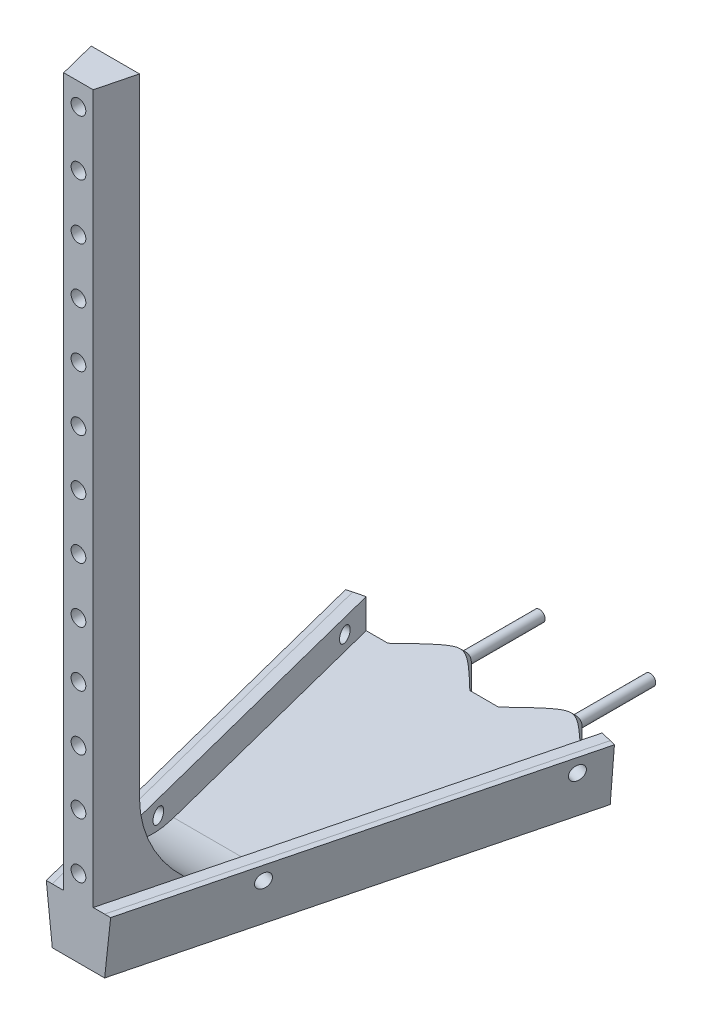
from build123d import *

# Parameters (mm, degrees)
BOSS_EXTRU_1_DEPTH                  = 7
BOSS_EXTRU_3_DEPTH                  = 200
ENL_V_MAT_EXTRU_1_REACH             = 232.486
ESQUISSE4_R                         = 2
ENL_V_MAT_EXTRU_1_DIRECTION_2_DEPTH = 231.486442118
CONG_1_R                            = 30
ESQUISSE6_R                         = 1.5
BOSS_EXTRU_4_DEPTH                  = 30
CHANFREIN1_SIZE                     = 10
R_P_TITION_LIN_AIRE1_COUNT          = 13
R_P_TITION_LIN_AIRE1_PITCH          = 15
BOSS_EXTRU_5_REACH                  = 238.518
ENL_V_MAT_EXTRU_2_REACH             = 249.28
ESQUISSE9_R                         = 2


with BuildPart() as part:
    # Esquisse1 → Boss.-Extru.1 (new body)
    with BuildSketch(Plane(origin=(0, 0, 0), x_dir=(1, 0, 0), z_dir=(0, 1, 0))):
        Polygon((-4, 0), (4, 0), (32, 110), (-32, 110), align=None)
    extrude(amount=-BOSS_EXTRU_1_DEPTH)

    # Esquisse3 → Boss.-Extru.3 (add)
    with BuildSketch(Plane(origin=(0, 0, 0), x_dir=(1, 0, 0), z_dir=(0, 1, 0))):
        Polygon((6.545454545, 10), (-6.545454545, 10), (-4, 0), (4, 0), align=None)
    extrude(amount=BOSS_EXTRU_3_DEPTH)

    # Esquisse4 → Enlèv. mat.-Extru.1 (cut, up to next)
    with BuildSketch(Plane.XY, mode=Mode.PRIVATE) as enl_v_mat_extru_1_sk1:
        with Locations(Location((0, 194, 0), (0, 0, 180))):
            Circle(ESQUISSE4_R)
    enl_v_mat_extru_1_tool1 = extrude(enl_v_mat_extru_1_sk1.sketch, amount=-ENL_V_MAT_EXTRU_1_REACH, mode=Mode.PRIVATE) & part.part
    enl_v_mat_extru_1 = enl_v_mat_extru_1_tool1.solids().sort_by_distance((0, 194, 0))[0]
    add(enl_v_mat_extru_1, mode=Mode.SUBTRACT)

    # Esquisse4 → Enlèv. mat.-Extru.1 direction 2 (cut)
    with BuildSketch(Plane.XY):
        with Locations(Location((0, 194, 0), (0, 0, 180))):
            Circle(ESQUISSE4_R)
    enl_v_mat_extru_1_direction_2 = extrude(amount=ENL_V_MAT_EXTRU_1_DIRECTION_2_DEPTH, mode=Mode.SUBTRACT)

    # Congé1
    cong_1_edges = [part.edges().sort_by_distance(p)[0] for p in [
        (0, 0, -10),
    ]]
    fillet(cong_1_edges, radius=CONG_1_R)

    # Esquisse6 → Boss.-Extru.4 (add)
    with BuildSketch(Plane(origin=(0, 0, -110), x_dir=(-1, 0, 0), z_dir=(0, 0, -1))):
        with Locations((-15, -3)):
            Circle(ESQUISSE6_R)
        with Locations((15, -3)):
            Circle(ESQUISSE6_R)
    extrude(amount=BOSS_EXTRU_4_DEPTH)

    # Chanfrein1
    # the kernel refuses this chamfer: 10 mm, written as the material it adds along each edge
    with BuildSketch(Plane(origin=(15, -3, -110), x_dir=(-1, 0, 0), z_dir=(0, -1, 0))) as chanfrein1_piece_1_section:
        Polygon((1.5 + CHANFREIN1_SIZE, 0), (1.5, CHANFREIN1_SIZE), (1.5, 0), align=None)
    chanfrein1_piece_1 = revolve(axis=Axis((15, -3, -110), (0, 0, -1)), mode=Mode.PRIVATE)
    chanfrein1_piece_1 = split(chanfrein1_piece_1, bisect_by=Plane(origin=(21.433559927, 0, -114.933559927), z_dir=(0, -1, 0)), keep=Keep.TOP, mode=Mode.PRIVATE)
    chanfrein1_piece_1 = split(chanfrein1_piece_1, bisect_by=Plane(origin=(21.433559927, -7, -114.933559927), z_dir=(0, 1, 0)), keep=Keep.TOP, mode=Mode.PRIVATE)
    add(chanfrein1_piece_1)
    with BuildSketch(Plane(origin=(-15, -3, -110), x_dir=(-1, 0, 0), z_dir=(0, -1, 0))) as chanfrein1_piece_2_section:
        Polygon((1.5 + CHANFREIN1_SIZE, 0), (1.5, CHANFREIN1_SIZE), (1.5, 0), align=None)
    chanfrein1_piece_2 = revolve(axis=Axis((-15, -3, -110), (0, 0, -1)), mode=Mode.PRIVATE)
    chanfrein1_piece_2 = split(chanfrein1_piece_2, bisect_by=Plane(origin=(-8.566440073, 0, -114.933559927), z_dir=(0, -1, 0)), keep=Keep.TOP, mode=Mode.PRIVATE)
    chanfrein1_piece_2 = split(chanfrein1_piece_2, bisect_by=Plane(origin=(-8.566440073, -7, -114.933559927), z_dir=(0, 1, 0)), keep=Keep.TOP, mode=Mode.PRIVATE)
    add(chanfrein1_piece_2)

    # Répétition linéaire1: Enlèv. mat.-Extru.1, Enlèv. mat.-Extru.1 direction 2; each copy of Enlèv. mat.-Extru.1 runs up to whatever stops it at its own place
    r_p_tition_lin_aire1_before = part.part  # the part as the pattern finds it: every copy runs up to it
    r_p_tition_lin_aire1_enl_v_mat_extru_1_long = extrude(enl_v_mat_extru_1_sk1.sketch, amount=-ENL_V_MAT_EXTRU_1_REACH, mode=Mode.PRIVATE)
    r_p_tition_lin_aire1_enl_v_mat_extru_1_tool1 = r_p_tition_lin_aire1_enl_v_mat_extru_1_long.moved(Location(Vector(0, -1, 0) * (1 * R_P_TITION_LIN_AIRE1_PITCH))) & r_p_tition_lin_aire1_before
    add(r_p_tition_lin_aire1_enl_v_mat_extru_1_tool1.solids().sort_by_distance((0, 179, 0))[0], mode=Mode.SUBTRACT)
    r_p_tition_lin_aire1_enl_v_mat_extru_1_tool2 = r_p_tition_lin_aire1_enl_v_mat_extru_1_long.moved(Location(Vector(0, -1, 0) * (2 * R_P_TITION_LIN_AIRE1_PITCH))) & r_p_tition_lin_aire1_before
    add(r_p_tition_lin_aire1_enl_v_mat_extru_1_tool2.solids().sort_by_distance((0, 164, 0))[0], mode=Mode.SUBTRACT)
    r_p_tition_lin_aire1_enl_v_mat_extru_1_tool3 = r_p_tition_lin_aire1_enl_v_mat_extru_1_long.moved(Location(Vector(0, -1, 0) * (3 * R_P_TITION_LIN_AIRE1_PITCH))) & r_p_tition_lin_aire1_before
    add(r_p_tition_lin_aire1_enl_v_mat_extru_1_tool3.solids().sort_by_distance((0, 149, 0))[0], mode=Mode.SUBTRACT)
    r_p_tition_lin_aire1_enl_v_mat_extru_1_tool4 = r_p_tition_lin_aire1_enl_v_mat_extru_1_long.moved(Location(Vector(0, -1, 0) * (4 * R_P_TITION_LIN_AIRE1_PITCH))) & r_p_tition_lin_aire1_before
    add(r_p_tition_lin_aire1_enl_v_mat_extru_1_tool4.solids().sort_by_distance((0, 134, 0))[0], mode=Mode.SUBTRACT)
    r_p_tition_lin_aire1_enl_v_mat_extru_1_tool5 = r_p_tition_lin_aire1_enl_v_mat_extru_1_long.moved(Location(Vector(0, -1, 0) * (5 * R_P_TITION_LIN_AIRE1_PITCH))) & r_p_tition_lin_aire1_before
    add(r_p_tition_lin_aire1_enl_v_mat_extru_1_tool5.solids().sort_by_distance((0, 119, 0))[0], mode=Mode.SUBTRACT)
    r_p_tition_lin_aire1_enl_v_mat_extru_1_tool6 = r_p_tition_lin_aire1_enl_v_mat_extru_1_long.moved(Location(Vector(0, -1, 0) * (6 * R_P_TITION_LIN_AIRE1_PITCH))) & r_p_tition_lin_aire1_before
    add(r_p_tition_lin_aire1_enl_v_mat_extru_1_tool6.solids().sort_by_distance((0, 104, 0))[0], mode=Mode.SUBTRACT)
    r_p_tition_lin_aire1_enl_v_mat_extru_1_tool7 = r_p_tition_lin_aire1_enl_v_mat_extru_1_long.moved(Location(Vector(0, -1, 0) * (7 * R_P_TITION_LIN_AIRE1_PITCH))) & r_p_tition_lin_aire1_before
    add(r_p_tition_lin_aire1_enl_v_mat_extru_1_tool7.solids().sort_by_distance((0, 89, 0))[0], mode=Mode.SUBTRACT)
    r_p_tition_lin_aire1_enl_v_mat_extru_1_tool8 = r_p_tition_lin_aire1_enl_v_mat_extru_1_long.moved(Location(Vector(0, -1, 0) * (8 * R_P_TITION_LIN_AIRE1_PITCH))) & r_p_tition_lin_aire1_before
    add(r_p_tition_lin_aire1_enl_v_mat_extru_1_tool8.solids().sort_by_distance((0, 74, 0))[0], mode=Mode.SUBTRACT)
    r_p_tition_lin_aire1_enl_v_mat_extru_1_tool9 = r_p_tition_lin_aire1_enl_v_mat_extru_1_long.moved(Location(Vector(0, -1, 0) * (9 * R_P_TITION_LIN_AIRE1_PITCH))) & r_p_tition_lin_aire1_before
    add(r_p_tition_lin_aire1_enl_v_mat_extru_1_tool9.solids().sort_by_distance((0, 59, 0))[0], mode=Mode.SUBTRACT)
    r_p_tition_lin_aire1_enl_v_mat_extru_1_tool10 = r_p_tition_lin_aire1_enl_v_mat_extru_1_long.moved(Location(Vector(0, -1, 0) * (10 * R_P_TITION_LIN_AIRE1_PITCH))) & r_p_tition_lin_aire1_before
    add(r_p_tition_lin_aire1_enl_v_mat_extru_1_tool10.solids().sort_by_distance((0, 44, 0))[0], mode=Mode.SUBTRACT)
    r_p_tition_lin_aire1_enl_v_mat_extru_1_tool11 = r_p_tition_lin_aire1_enl_v_mat_extru_1_long.moved(Location(Vector(0, -1, 0) * (11 * R_P_TITION_LIN_AIRE1_PITCH))) & r_p_tition_lin_aire1_before
    add(r_p_tition_lin_aire1_enl_v_mat_extru_1_tool11.solids().sort_by_distance((0, 29, 0))[0], mode=Mode.SUBTRACT)
    r_p_tition_lin_aire1_enl_v_mat_extru_1_tool12 = r_p_tition_lin_aire1_enl_v_mat_extru_1_long.moved(Location(Vector(0, -1, 0) * (12 * R_P_TITION_LIN_AIRE1_PITCH))) & r_p_tition_lin_aire1_before
    add(r_p_tition_lin_aire1_enl_v_mat_extru_1_tool12.solids().sort_by_distance((0, 14, 0))[0], mode=Mode.SUBTRACT)
    add(enl_v_mat_extru_1_direction_2.moved(Location(Vector(0, -1, 0) * (1 * R_P_TITION_LIN_AIRE1_PITCH))), mode=Mode.SUBTRACT)
    add(enl_v_mat_extru_1_direction_2.moved(Location(Vector(0, -1, 0) * (2 * R_P_TITION_LIN_AIRE1_PITCH))), mode=Mode.SUBTRACT)
    add(enl_v_mat_extru_1_direction_2.moved(Location(Vector(0, -1, 0) * (3 * R_P_TITION_LIN_AIRE1_PITCH))), mode=Mode.SUBTRACT)
    add(enl_v_mat_extru_1_direction_2.moved(Location(Vector(0, -1, 0) * (4 * R_P_TITION_LIN_AIRE1_PITCH))), mode=Mode.SUBTRACT)
    add(enl_v_mat_extru_1_direction_2.moved(Location(Vector(0, -1, 0) * (5 * R_P_TITION_LIN_AIRE1_PITCH))), mode=Mode.SUBTRACT)
    add(enl_v_mat_extru_1_direction_2.moved(Location(Vector(0, -1, 0) * (6 * R_P_TITION_LIN_AIRE1_PITCH))), mode=Mode.SUBTRACT)
    add(enl_v_mat_extru_1_direction_2.moved(Location(Vector(0, -1, 0) * (7 * R_P_TITION_LIN_AIRE1_PITCH))), mode=Mode.SUBTRACT)
    add(enl_v_mat_extru_1_direction_2.moved(Location(Vector(0, -1, 0) * (8 * R_P_TITION_LIN_AIRE1_PITCH))), mode=Mode.SUBTRACT)
    add(enl_v_mat_extru_1_direction_2.moved(Location(Vector(0, -1, 0) * (9 * R_P_TITION_LIN_AIRE1_PITCH))), mode=Mode.SUBTRACT)
    add(enl_v_mat_extru_1_direction_2.moved(Location(Vector(0, -1, 0) * (10 * R_P_TITION_LIN_AIRE1_PITCH))), mode=Mode.SUBTRACT)
    add(enl_v_mat_extru_1_direction_2.moved(Location(Vector(0, -1, 0) * (11 * R_P_TITION_LIN_AIRE1_PITCH))), mode=Mode.SUBTRACT)
    add(enl_v_mat_extru_1_direction_2.moved(Location(Vector(0, -1, 0) * (12 * R_P_TITION_LIN_AIRE1_PITCH))), mode=Mode.SUBTRACT)

    # Boss.-Extru.5: up to this plane
    boss_extru_5_end = Plane(origin=(-4, -7, 0), z_dir=(0, 0, 1))
    # Esquisse8 → Boss.-Extru.5 (add, up to the surface)
    with BuildSketch(Plane(origin=(-28.24340267, 0, -110.956224775), x_dir=(0, 1, 0), z_dir=(0.24667928063493072, 0, 0.9690971739229421)), mode=Mode.PRIVATE) as boss_extru_5_sk1:
        Polygon((-7, 6.876388696), (-7, 3.876388696), (8, 3.876388696), (8, 6.876388696), (7.995776411, 8.452508308), align=None)
    boss_extru_5_tool1 = split(extrude(boss_extru_5_sk1.sketch, amount=BOSS_EXTRU_5_REACH, mode=Mode.PRIVATE), bisect_by=boss_extru_5_end, keep=Keep.BOTH, mode=Mode.PRIVATE)
    boss_extru_5 = boss_extru_5_tool1.solids().sort_by_distance((-33.861979, 1.019802, -109.526042))[0]
    add(boss_extru_5)

    # Enlèv. mat.-Extru.2: up to this plane
    enl_v_mat_extru_2_end = Plane(origin=(-3.753124552, -0.791324198, 15.776778701), z_dir=(-0.9637883582058816, -0.10452846326765404, 0.24532794572513353))
    # Esquisse9 → Enlèv. mat.-Extru.2 (cut, up to the surface)
    with BuildSketch(Plane(origin=(-3.75659733, 0, 0.956224775), x_dir=(-0.24667928063493078, 0, -0.9690971739229421), z_dir=(0.9690971739229421, 0, -0.24667928063493078)), mode=Mode.PRIVATE) as enl_v_mat_extru_2_sk1:
        with Locations((36.494426112, 4)):
            Circle(ESQUISSE9_R)
    enl_v_mat_extru_2_tool1 = split(extrude(enl_v_mat_extru_2_sk1.sketch, amount=-ENL_V_MAT_EXTRU_2_REACH, mode=Mode.PRIVATE), bisect_by=enl_v_mat_extru_2_end, keep=Keep.BOTH, mode=Mode.PRIVATE)
    # Esquisse9 → Enlèv. mat.-Extru.2 (cut, up to the surface)
    with BuildSketch(Plane(origin=(-3.75659733, 0, 0.956224775), x_dir=(-0.24667928063493078, 0, -0.9690971739229421), z_dir=(0.9690971739229421, 0, -0.24667928063493078)), mode=Mode.PRIVATE) as enl_v_mat_extru_2_sk2:
        with Locations((106.494426112, 4)):
            Circle(ESQUISSE9_R)
    enl_v_mat_extru_2_tool2 = split(extrude(enl_v_mat_extru_2_sk2.sketch, amount=-ENL_V_MAT_EXTRU_2_REACH, mode=Mode.PRIVATE), bisect_by=enl_v_mat_extru_2_end, keep=Keep.BOTH, mode=Mode.PRIVATE)
    enl_v_mat_extru_2 = enl_v_mat_extru_2_tool1.solids().sort_by_distance((-12.759016, 4, -34.41042))[0] + enl_v_mat_extru_2_tool2.solids().sort_by_distance((-30.026566, 4, -102.247223))[0]
    add(enl_v_mat_extru_2, mode=Mode.SUBTRACT)

    # Symétrie1: Boss.-Extru.5, Enlèv. mat.-Extru.2 across plane
    add(boss_extru_5.mirror(Plane(origin=(0, 0, 0), x_dir=(0, 0, 1), z_dir=(1, 0, 0))))
    add(enl_v_mat_extru_2.mirror(Plane(origin=(0, 0, 0), x_dir=(0, 0, 1), z_dir=(1, 0, 0))), mode=Mode.SUBTRACT)


solid = part.part
